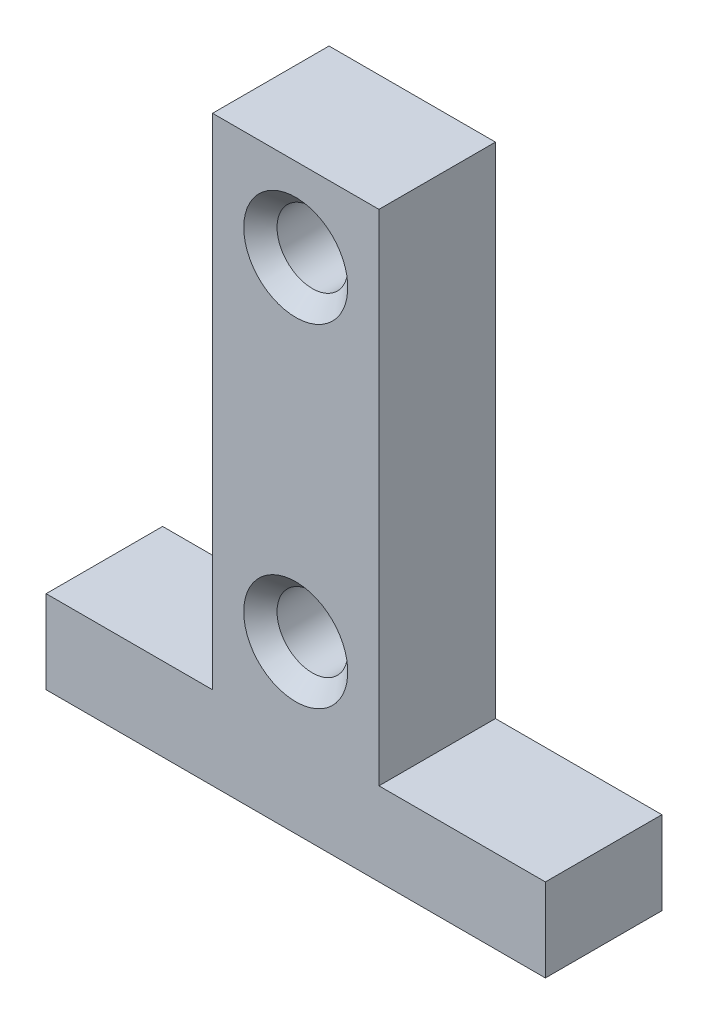
from build123d import *

# Parameters (mm, degrees)
SKETCH1_W           = 10
SKETCH1_H           = 30
BOSS_EXTRUDE1_DEPTH = 7
SKETCH2_R           = 2.125
CUT_EXTRUDE1_DEPTH  = 7
CHAMFER1_SIZE       = 1
SKETCH3_W           = 30
SKETCH3_H           = 7
BOSS_EXTRUDE2_DEPTH = 5


with BuildPart() as part:
    # Sketch1 → Boss-Extrude1 (new body)
    with BuildSketch(Plane.XY):
        with Locations((5, 15)):
            Rectangle(SKETCH1_W, SKETCH1_H)
    extrude(amount=BOSS_EXTRUDE1_DEPTH)

    # Sketch2 → Cut-Extrude1 (cut)
    with BuildSketch(Plane.XY.offset(7)):
        with Locations((5, 25)):
            Circle(SKETCH2_R)
        with Locations((5, 5)):
            Circle(SKETCH2_R)
    extrude(amount=-CUT_EXTRUDE1_DEPTH, mode=Mode.SUBTRACT)

    # Chamfer1
    chamfer1_edges = [part.edges().sort_by_distance(p)[0] for p in [
        (2.875, 5, 7),
        (2.875, 25, 7),
    ]]
    chamfer(chamfer1_edges, length=CHAMFER1_SIZE)

    # Sketch3 → Boss-Extrude2 (add)
    with BuildSketch(Plane.XZ):
        with Locations((5, 3.5)):
            Rectangle(SKETCH3_W, SKETCH3_H)
    extrude(amount=BOSS_EXTRUDE2_DEPTH)


solid = part.part
